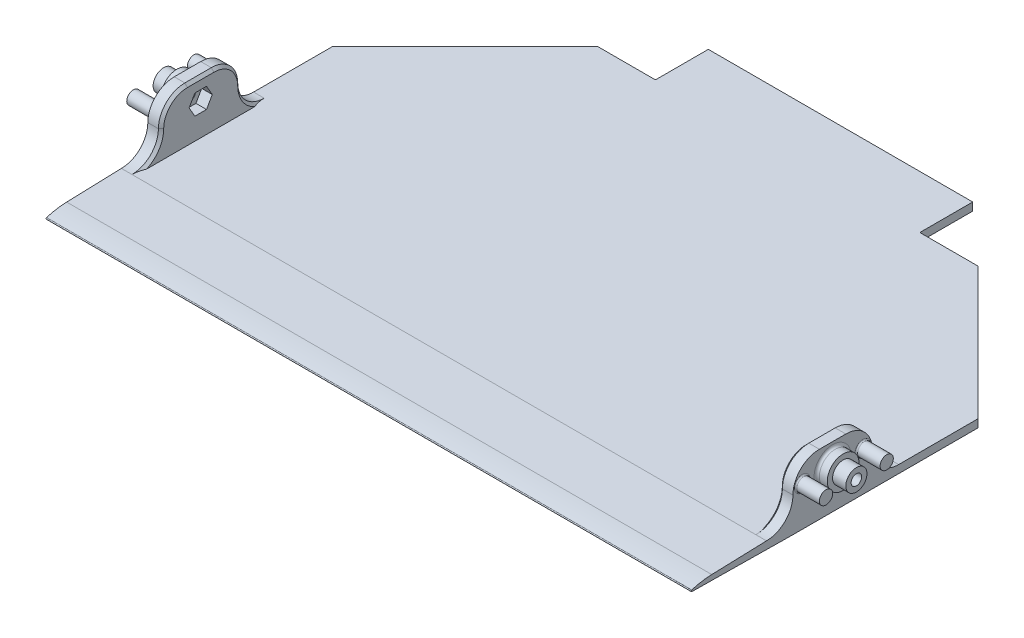
from build123d import *

# Parameters (mm, degrees)
BOSS_EXTRUDE1_DEPTH       = 3
SKETCH2_W                 = 5
SKETCH2_H                 = 30
BOSS_EXTRUDE2_DEPTH       = 20
BOSS_EXTRUDE3_DEPTH       = 4
BOSS_EXTRUDE3_DEPTH_BACK  = 244
SKETCH3_R                 = 6
SKETCH5_R                 = 2
CUT_EXTRUDE2_DEPTH        = 269.389642125
FILLET1_R                 = 10
BOSS_EXTRUDE4_START       = 5
SKETCH6_R                 = 4
SKETCH6_R_2               = 2
BOSS_EXTRUDE4_DEPTH       = 5
CUT_EXTRUDE3_DEPTH        = 238
CUT_EXTRUDE3_DEPTH_BACK   = 4
CUT_EXTRUDE4_DEPTH        = 265.697941057
FILLET9_R                 = 30
FILLET10_R                = 0.3
CUT_EXTRUDE6_DEPTH        = 167.015059558
SKETCH13_R                = 6
SKETCH13_R_2              = 2
BOSS_EXTRUDE7_DEPTH       = 4
SKETCH14_R                = 4
SKETCH14_R_2              = 2
BOSS_EXTRUDE8_DEPTH       = 5
FILLET11_R                = 1
SKETCH15_W                = 144
SKETCH15_H                = 5
BOSS_EXTRUDE9_DEPTH       = 6
FILLET12_R                = 3
BOSS_EXTRUDE10_DEPTH      = 9
BOSS_EXTRUDE10_DEPTH_BACK = 253
SKETCH16_R                = 2.5
FILLET13_R                = 0.5
CUT_EXTRUDE7_DEPTH        = 167.403124971
CUT_EXTRUDE7_DEPTH_BACK   = 167.403124971
SKETCH17_W                = 234
SKETCH17_H                = 22.465273377
CHAMFER1_SIZE             = 1


# Some blends are built 0.0001 mm under size
with BuildPart() as part:
    # Sketch1 → Boss-Extrude1 (new body)
    with BuildSketch(Plane(origin=(0, 0, 0), x_dir=(1, 0, 0), z_dir=(0, 1, 0))):
        Polygon((-122, -80), (122, -80), (122, 80), (50, 80), (50, 100), (-50, 100), (-50, 80), (-122, 80), align=None)
    extrude(amount=BOSS_EXTRUDE1_DEPTH)

    # Sketch2 → Boss-Extrude2 (add)
    with BuildSketch(Plane(origin=(0, 3, 0), x_dir=(1, 0, 0), z_dir=(0, 1, 0))):
        with Locations((-119.5, -25)):
            Rectangle(SKETCH2_W, SKETCH2_H)
        with Locations((119.5, -25)):
            Rectangle(SKETCH2_W, SKETCH2_H)
    extrude(amount=BOSS_EXTRUDE2_DEPTH)

    # Sketch3 → Boss-Extrude3 (add, two sides: drawn at the far end of the back side and taken through both)
    with BuildSketch(Plane.ZY.offset(122).offset(-BOSS_EXTRUDE3_DEPTH_BACK)):
        with Locations((25, 15)):
            Circle(SKETCH3_R)
    extrude(amount=BOSS_EXTRUDE3_DEPTH + BOSS_EXTRUDE3_DEPTH_BACK)

    # Sketch5 → Cut-Extrude2 (cut, through all)
    with BuildSketch(Plane.ZY.offset(126)):
        with Locations((25, 15)):
            Circle(SKETCH5_R)
    extrude(amount=-CUT_EXTRUDE2_DEPTH, mode=Mode.SUBTRACT)

    # Fillet1
    fillet1_edges = [part.edges().sort_by_distance(p)[0] for p in [
        (119.5, 3, 40),
        (119.5, 3, 10),
        (-119.5, 3, 10),
        (-119.5, 3, 40),
    ]]
    fillet(fillet1_edges, radius=FILLET1_R)
    fillet1_2_edges = [part.edges().sort_by_distance(p)[0] for p in [
        (119.5, 23, 40),
        (119.5, 23, 10),
        (-119.5, 23, 10),
        (-119.5, 23, 40),
    ]]
    fillet(fillet1_2_edges, radius=FILLET1_R - 0.0001)  # a hair under: the kernel refuses the full size

    # Sketch6 → Boss-Extrude4 (add)
    with BuildSketch(Plane.ZY.offset(126).offset(BOSS_EXTRUDE4_START)):
        with Locations((25, 15)):
            Circle(SKETCH6_R)
        with Locations((25, 15)):
            Circle(SKETCH6_R_2, mode=Mode.SUBTRACT)
    extrude(amount=-BOSS_EXTRUDE4_DEPTH)

    # Sketch8 → Cut-Extrude3 (cut, two sides: drawn at the far end of the back side and taken through both)
    with BuildSketch(Plane.ZY.offset(-117).offset(-CUT_EXTRUDE3_DEPTH_BACK)):
        Polygon((29.387862046, 15), (27.193931023, 18.8), (22.806068977, 18.8), (20.612137954, 15), (22.806068977, 11.2), (27.193931023, 11.2), align=None)
    extrude(amount=CUT_EXTRUDE3_DEPTH + CUT_EXTRUDE3_DEPTH_BACK, mode=Mode.SUBTRACT)

    # Sketch9 → Cut-Extrude4 (cut, through all)
    with BuildSketch(Plane.ZY.offset(122)):
        Polygon((40, 0), (80, 0), (80, 0.5), align=None)
        Polygon((50, 3), (80, 2), (80, 3), align=None)
    extrude(amount=-CUT_EXTRUDE4_DEPTH, mode=Mode.SUBTRACT)

    # Fillet9
    # the kernel refuses this fillet: 30 mm, written as the material it takes off along each edge
    with BuildSketch(Plane(origin=(-145.287477803, 2, 80), x_dir=(0, -1.0, -1.3358203432240998e-12), z_dir=(1, 0, 0))) as fillet9_piece_1:
        with BuildLine():
            CenterArc((29.673019862, 10.309265341), FILLET9_R, 181.909152433, 18.189778856)
            Line((-0.310327348, 9.309820434), (-0.909994292, 9.289831536))
            Line((-0.909994292, 9.289831536), (-0.599666944, -0.019988898))
            Line((-0.599666944, -0.019988898), (0, -0.6))
            ThreePointArc((0, -0.6), (0.75, -0.6), (0.936539603, -0.206185307))
            Line((0.936539603, -0.206185307), (1.5, 0))
        make_face()
    extrude(amount=290.574955605, mode=Mode.SUBTRACT)

    # Fillet10
    fillet10_edges = [part.edges().sort_by_distance(p)[0] for p in [
        (0, 0.5, 80),
    ]]
    fillet(fillet10_edges, radius=FILLET10_R)

    # Sketch12 → Cut-Extrude6 (cut, through all)
    with BuildSketch(Plane(origin=(0, 3, 0), x_dir=(1, 0, 0), z_dir=(0, 1, 0))):
        Polygon((-72, 80), (-122, 30), (-122, 80), align=None)
        Polygon((72, 80), (122, 80), (122, 30), align=None)
    extrude(amount=-CUT_EXTRUDE6_DEPTH, mode=Mode.SUBTRACT)

    # Sketch13 → Boss-Extrude7 (add)
    with BuildSketch(Plane(origin=(122, 0, 0), x_dir=(0, 0, -1), z_dir=(1, 0, 0))):
        with Locations(Location((-25, 15, 0), (0, 0, 180))):
            Circle(SKETCH13_R)
        with Locations(Location((-25, 15, 0), (0, 0, 180))):
            Circle(SKETCH13_R_2, mode=Mode.SUBTRACT)
    extrude(amount=BOSS_EXTRUDE7_DEPTH)

    # Sketch14 → Boss-Extrude8 (add)
    with BuildSketch(Plane(origin=(126, 0, 0), x_dir=(0, 0, -1), z_dir=(1, 0, 0))):
        with Locations(Location((-25, 15, 0), (0, 0, 180))):
            Circle(SKETCH14_R)
        with Locations(Location((-25, 15, 0), (0, 0, 180))):
            Circle(SKETCH14_R_2, mode=Mode.SUBTRACT)
    extrude(amount=BOSS_EXTRUDE8_DEPTH)

    # Fillet11
    fillet11_edges = [part.edges().sort_by_distance(p)[0] for p in [
        (122, 15, 19),
        (-122, 15, 19),
    ]]
    fillet(fillet11_edges, radius=FILLET11_R)

    # Sketch15 → Boss-Extrude9 (add)
    with BuildSketch(Plane.XZ):
        with Locations((0, -77.5)):
            Rectangle(SKETCH15_W, SKETCH15_H)
    extrude(amount=BOSS_EXTRUDE9_DEPTH)

    # Fillet12
    fillet12_edges = [part.edges().sort_by_distance(p)[0] for p in [
        (0, 0, -75),
    ]]
    fillet(fillet12_edges, radius=FILLET12_R)

    # Sketch16 → Boss-Extrude10 (add, two sides: drawn at the far end of the back side and taken through both)
    with BuildSketch(Plane.ZY.offset(122).offset(-BOSS_EXTRUDE10_DEPTH_BACK)):
        with Locations((36.48, 15)):
            Circle(SKETCH16_R)
        with Locations((13.52, 15)):
            Circle(SKETCH16_R)
    extrude(amount=BOSS_EXTRUDE10_DEPTH + BOSS_EXTRUDE10_DEPTH_BACK)

    # Fillet13
    fillet13_edges = [part.edges().sort_by_distance(p)[0] for p in [
        (-122, 15, 33.98),
        (122, 15, 33.98),
        (-122, 15, 11.02),
        (122, 15, 11.02),
    ]]
    fillet(fillet13_edges, radius=FILLET13_R)

    # Sketch17 → Cut-Extrude7 (cut, two sides: drawn at the far end of the back side and taken through both)
    with BuildSketch(Plane.XY.offset(-CUT_EXTRUDE7_DEPTH_BACK)):
        with Locations((0, 16.231336637)):
            Rectangle(SKETCH17_W, SKETCH17_H)
    extrude(amount=CUT_EXTRUDE7_DEPTH + CUT_EXTRUDE7_DEPTH_BACK, mode=Mode.SUBTRACT)

    # Chamfer1
    # the kernel refuses this chamfer: 1 mm, written as the material it takes off along each edge
    with BuildSketch(Plane(origin=(117, 23, 19.9999), x_dir=(-0.0274958766105822, -0.999621916911297, 0), z_dir=(0, 0, 1)), Plane(origin=(-117, 23, 30.0001), x_dir=(0.0274958766105822, -0.999621916911297, 0), z_dir=(0, 0, -1))) as chamfer1_piece_1:
        Polygon((CHAMFER1_SIZE * 0.999621916911, CHAMFER1_SIZE * 0.0274958766106), (-CHAMFER1_SIZE * 0.0274958766106, CHAMFER1_SIZE * 0.999621916911), (0, 0), align=None)
    extrude(amount=10.0002, mode=Mode.SUBTRACT)
    with BuildSketch(Plane(origin=(117, 13.0001, 19.9999), x_dir=(0, 0, -1), z_dir=(0, -1, 0))) as chamfer1_piece_2:
        Polygon((9.9999 - CHAMFER1_SIZE, 0), (9.9999, CHAMFER1_SIZE), (9.9999, 0), align=None)
    revolve(axis=Axis((117, 13.0001, 19.9999), (1, 0, 0)), revolution_arc=90, mode=Mode.SUBTRACT)
    with BuildSketch(Plane(origin=(117, 13.0001, 30.0001), x_dir=(0, 1, 0), z_dir=(0, 0, -1))) as chamfer1_piece_3:
        Polygon((9.9999 - CHAMFER1_SIZE, 0), (9.9999, CHAMFER1_SIZE), (9.9999, 0), align=None)
    revolve(axis=Axis((117, 13.0001, 30.0001), (1, 0, 0)), revolution_arc=90, mode=Mode.SUBTRACT)
    with BuildSketch(Plane(origin=(-117, 13.0001, 30.0001), x_dir=(0, 0, 1), z_dir=(0, -1, 0))) as chamfer1_piece_4:
        Polygon((9.9999 - CHAMFER1_SIZE, 0), (9.9999, CHAMFER1_SIZE), (9.9999, 0), align=None)
    revolve(axis=Axis((-117, 13.0001, 30.0001), (-1, 0, 0)), revolution_arc=90, mode=Mode.SUBTRACT)
    with BuildSketch(Plane(origin=(-117, 13.0001, 19.9999), x_dir=(0, 1, 0), z_dir=(0, 0, 1))) as chamfer1_piece_5:
        Polygon((9.9999 - CHAMFER1_SIZE, 0), (9.9999, CHAMFER1_SIZE), (9.9999, 0), align=None)
    revolve(axis=Axis((-117, 13.0001, 19.9999), (-1, 0, 0)), revolution_arc=90, mode=Mode.SUBTRACT)
    with BuildSketch(Plane(origin=(117, 13, 50), x_dir=(0, 0, -1), z_dir=(0, 1, 0))) as chamfer1_piece_6_section:
        Polygon((10 + CHAMFER1_SIZE, 0), (10, -CHAMFER1_SIZE), (10, 0), align=None)
    chamfer1_piece_6 = revolve(axis=Axis((117, 13, 50), (-1, 0, 0)), revolution_arc=104.740577178, mode=Mode.PRIVATE)
    chamfer1_piece_6 = split(chamfer1_piece_6, bisect_by=Plane(origin=(117.284199565, 3, 39.712776606), z_dir=(0, 1, 0)), keep=Keep.TOP, mode=Mode.PRIVATE)
    add(chamfer1_piece_6, mode=Mode.SUBTRACT)
    with BuildSketch(Plane(origin=(117, 13, 0), x_dir=(2.842170943040401e-15, -0.9670877974864588, -0.25444290509422757), z_dir=(1.1455930525457092e-14, 0.25444290509422757, -0.9670877974864588))) as chamfer1_piece_7_section:
        Polygon((10 + CHAMFER1_SIZE, 0), (10, -CHAMFER1_SIZE), (10, 0), align=None)
    chamfer1_piece_7 = revolve(axis=Axis((117, 13, 0), (-1, 0, 0)), revolution_arc=104.740577178, mode=Mode.PRIVATE)
    chamfer1_piece_7 = split(chamfer1_piece_7, bisect_by=Plane(origin=(117.487389682, 3, 7.415704361), z_dir=(0, 1, 0)), keep=Keep.TOP, mode=Mode.PRIVATE)
    add(chamfer1_piece_7, mode=Mode.SUBTRACT)
    with BuildSketch(Plane(origin=(-117, 13, 0), x_dir=(0, 0, 1), z_dir=(0, 1, 0))) as chamfer1_piece_8_section:
        Polygon((10 + CHAMFER1_SIZE, 0), (10, -CHAMFER1_SIZE), (10, 0), align=None)
    chamfer1_piece_8 = revolve(axis=Axis((-117, 13, 0), (1, 0, 0)), revolution_arc=104.740577178, mode=Mode.PRIVATE)
    chamfer1_piece_8 = split(chamfer1_piece_8, bisect_by=Plane(origin=(-117.284199565, 3, 10.287223394), z_dir=(0, 1, 0)), keep=Keep.TOP, mode=Mode.PRIVATE)
    add(chamfer1_piece_8, mode=Mode.SUBTRACT)
    with BuildSketch(Plane(origin=(-117, 13, 50), x_dir=(0, -0.9670877974864587, 0.2544429050942284), z_dir=(0, 0.2544429050942284, 0.9670877974864587))) as chamfer1_piece_9_section:
        Polygon((10 + CHAMFER1_SIZE, 0), (10, -CHAMFER1_SIZE), (10, 0), align=None)
    chamfer1_piece_9 = revolve(axis=Axis((-117, 13, 50), (1, 0, 0)), revolution_arc=104.740577178, mode=Mode.PRIVATE)
    chamfer1_piece_9 = split(chamfer1_piece_9, bisect_by=Plane(origin=(-117.335701198, 3, 47.436770864), z_dir=(0, 1, 0)), keep=Keep.TOP, mode=Mode.PRIVATE)
    add(chamfer1_piece_9, mode=Mode.SUBTRACT)
    with BuildSketch(Plane(origin=(-117, 13, 40), x_dir=(0.027495876610582105, 0, -0.999621916911297), z_dir=(0, 1, 0)), Plane(origin=(117, 13, 10), x_dir=(-0.0274958766105822, 0, 0.999621916911297), z_dir=(0, 1, 0))) as chamfer1_piece_10:
        Polygon((CHAMFER1_SIZE * 0.999621916911, CHAMFER1_SIZE * 0.0274958766106), (-CHAMFER1_SIZE * 0.0274958766106, CHAMFER1_SIZE * 0.999621916911), (0, 0), align=None)
    extrude(amount=0.0001, mode=Mode.SUBTRACT)
    with BuildSketch(Plane(origin=(-117, 13, 10), x_dir=(0.027495876610582247, 0, 0.999621916911297), z_dir=(0, 1, 0)), Plane(origin=(117, 13, 40), x_dir=(-0.027495876610582105, 0, -0.999621916911297), z_dir=(0, 1, 0))) as chamfer1_piece_11:
        Polygon((CHAMFER1_SIZE * 0.999621916911, -CHAMFER1_SIZE * 0.0274958766106), (-CHAMFER1_SIZE * 0.0274958766106, -CHAMFER1_SIZE * 0.999621916911), (0, 0), align=None)
    extrude(amount=0.0001, mode=Mode.SUBTRACT)


solid = part.part
